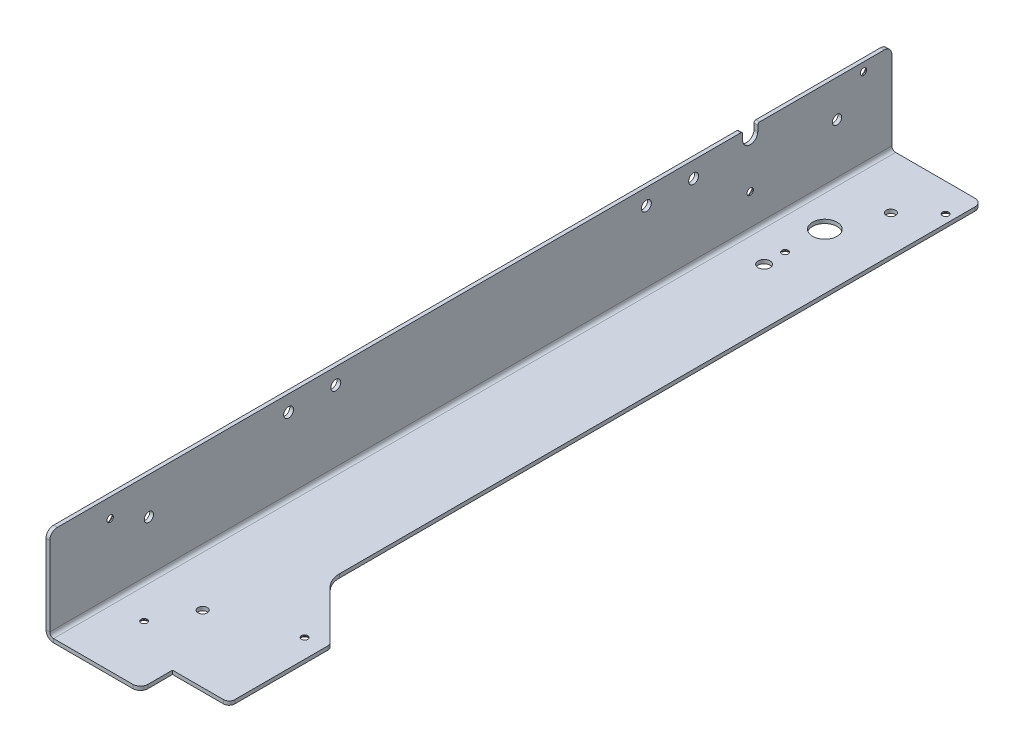
from build123d import *

# Parameters (mm, degrees)
BOSS_EXTRUDE1_DEPTH                            = 2
HOLE1_D                                        = 5.25
HOLE2_D                                        = 5.25
F_13_0_13_DIAMETER_HOLE1_D                     = 13
F_6_3_6_3_DIAMETER_HOLE1_D                     = 6.3
HOLE3_D                                        = 4.917
CSK_FOR_M3_FLAT_HEAD_MACHINE_SCREW1_AT_2_COUNT = 2
CSK_FOR_M3_FLAT_HEAD_MACHINE_SCREW1_AT_2_PITCH = 399.037905468
CSK_FOR_M3_FLAT_HEAD_MACHINE_SCREW1_AT_3_COUNT = 2
CSK_FOR_M3_FLAT_HEAD_MACHINE_SCREW1_AT_3_PITCH = 56.712388981
CSK_FOR_M3_FLAT_HEAD_MACHINE_SCREW1_AT_4_COUNT = 2
CSK_FOR_M3_FLAT_HEAD_MACHINE_SCREW1_AT_4_PITCH = 407.381733638
CSK_FOR_M3_FLAT_HEAD_MACHINE_SCREW1_AT_5_COUNT = 2
CSK_FOR_M3_FLAT_HEAD_MACHINE_SCREW1_AT_5_PITCH = 343.793917126
CSK_FOR_M3_FLAT_HEAD_MACHINE_SCREW1_AT_6_COUNT = 2
CSK_FOR_M3_FLAT_HEAD_MACHINE_SCREW1_AT_6_PITCH = 112.305538429
CSK_FOR_M3_FLAT_HEAD_MACHINE_SCREW1_AT_7_COUNT = 2
CSK_FOR_M3_FLAT_HEAD_MACHINE_SCREW1_AT_7_PITCH = 339.560377547
SKETCHED_START                                 = -46.712388981
SKETCHED_BEND1_OUTLINE_W                       = 2
SKETCHED_BEND1_OUTLINE_H                       = 446
SKETCHED_BEND1_DEPTH                           = 47.123348981
SKETCHED_START_2                               = 1.400733564
SKETCHED_BEND1_2_OUTLINE_R                     = 1.7
SKETCHED_BEND1_2_OUTLINE_R_2                   = 2.4585
SKETCHED_BEND1_2_OUTLINE_R_3                   = 2.625
SKETCHED_BEND1_2_DEPTH                         = 0.599266436
SKETCHED_BEND1_3_OUTLINE_R                     = 1.7
SKETCHED_BEND1_3_OUTLINE_R_2                   = 2.4585
SKETCHED_BEND1_3_OUTLINE_R_3                   = 2.625
SKETCHED_BEND1_3_DEPTH                         = 4
SKETCHED_START_3                               = -224
SKETCHED_BEND1_4_DEPTH                         = 448


with BuildPart() as part:
    # Sketch5 → Boss-Extrude1 (new body)
    with BuildSketch(Plane.XZ):
        with BuildLine():
            Line((46, 223), (-42.712388981, 223))
            ThreePointArc((-42.712388981, 223), (-45.540816105, 221.828427125), (-46.712388981, 219))
            Line((-46.712388981, 219), (-46.712388981, -143))
            ThreePointArc((-46.712388981, -143), (-46.419495767, -143.707106769), (-45.712388998, -143.999999983))
            Line((-45.712388998, -143.999999983), (-42.712388996, -143.999999983))
            ThreePointArc((-42.712388996, -143.999999983), (-38.712388981, -147.999999998), (-42.712388996, -152.000000013))
            Line((-42.712388996, -152.000000013), (-45.712388993, -152.000000013))
            ThreePointArc((-45.712388993, -152.000000013), (-46.419495765, -152.292893228), (-46.712388981, -153))
            Line((-46.712388981, -153), (-46.712388981, -219))
            ThreePointArc((-46.712388981, -219), (-45.540816105, -221.828427125), (-42.712388981, -223))
            Line((-42.712388981, -223), (46, -223))
            ThreePointArc((46, -223), (48.828427126, -221.828427124), (50.000000002, -218.999999998))
            Line((50.000000002, -218.999999998), (50.000000002, 117.529437254))
            ThreePointArc((50.000000002, 117.529437254), (50.91344561, 122.121638435), (53.514718622, 126.014718614))
            Line((53.514718622, 126.014718614), (79.121320339, 151.621320331))
            ThreePointArc((79.121320339, 151.621320331), (79.771638601, 152.594590389), (80.000000006, 153.742640699))
            Line((80.000000006, 153.742640699), (80.000000006, 203.000000012))
            ThreePointArc((80.000000006, 203.000000012), (79.121320352, 205.12132035), (77.000000014, 206.000000004))
            Line((77.000000014, 206.000000004), (50.000000002, 206.000000004))
            Line((50.000000002, 206.000000004), (50.000000002, 218.999999998))
            ThreePointArc((50.000000002, 218.999999998), (48.828427126, 221.828427124), (46, 223))
        make_face()
    extrude(amount=-BOSS_EXTRUDE1_DEPTH)

    # Hole1 (through all)
    with Locations(Plane(origin=(0, 0, 0), x_dir=(-1, 0, 0), z_dir=(0, -1, 0))):
        with Locations((38.212388981, 118)):
            Hole(HOLE1_D / 2)

    # Hole2 (through all)
    with Locations(Plane(origin=(0, 2, 0), x_dir=(1, 0, 0), z_dir=(0, 1, 0))):
        with Locations((-38.212388981, 93), (-38.212388981, -71.5), (-38.212388981, -96.5)):
            Hole(HOLE2_D / 2)

    # Ø13.0 (13) Diameter Hole1 (through all)
    with Locations(Plane(origin=(0, 2, 0), x_dir=(1, 0, 0), z_dir=(0, 1, 0))):
        with Locations((20.5, 169)):
            Hole(F_13_0_13_DIAMETER_HOLE1_D / 2)

    # Ø6.3 (6.3) Diameter Hole1 (through all)
    with Locations(Plane(origin=(0, 2, 0), x_dir=(1, 0, 0), z_dir=(0, 1, 0))):
        with Locations((20.5, 136.85)):
            Hole(F_6_3_6_3_DIAMETER_HOLE1_D / 2)

    # Hole3 (through all)
    with Locations(Plane(origin=(0, 2, 0), x_dir=(1, 0, 0), z_dir=(0, 1, 0))):
        with Locations((30.5, -170.5), (30.5, 194), (-27.212388981, -170.5), (-27.212388981, 194)):
            Hole(HOLE3_D / 2)

    # Sketch16 → CSK for M3 Flat Head Machine Screw1 (revolve, cut)
    with BuildSketch(Plane(origin=(-36.712388981, 0, 191), x_dir=(0, 0, -1), z_dir=(1, 0, 0))):
        Polygon((0, 0), (0, 2), (1.7, 2), (1.7, 1.450000002), (3.149999999, 0), align=None)
    csk_for_m3_flat_head_machine_screw1 = revolve(axis=Axis((-36.712388981, -6.35, 191), (0, 1, 0)), mode=Mode.SUBTRACT)

    # CSK for M3 Flat Head Machine Screw1 at 2: CSK for M3 Flat Head Machine Screw1 ×2
    with Locations(*[Vector(-0.013783151737312926, 0, -0.999905007852339) * (i * CSK_FOR_M3_FLAT_HEAD_MACHINE_SCREW1_AT_2_PITCH) for i in range(1, CSK_FOR_M3_FLAT_HEAD_MACHINE_SCREW1_AT_2_COUNT)]):
        add(csk_for_m3_flat_head_machine_screw1, mode=Mode.SUBTRACT)

    # CSK for M3 Flat Head Machine Screw1 at 3: CSK for M3 Flat Head Machine Screw1 ×2
    with Locations(*[(i * CSK_FOR_M3_FLAT_HEAD_MACHINE_SCREW1_AT_3_PITCH, 0, 0) for i in range(1, CSK_FOR_M3_FLAT_HEAD_MACHINE_SCREW1_AT_3_COUNT)]):
        add(csk_for_m3_flat_head_machine_screw1, mode=Mode.SUBTRACT)

    # CSK for M3 Flat Head Machine Screw1 at 4: CSK for M3 Flat Head Machine Screw1 ×2
    with Locations(*[Vector(0.20180676302394304, 0, -0.9794253572364757) * (i * CSK_FOR_M3_FLAT_HEAD_MACHINE_SCREW1_AT_4_PITCH) for i in range(1, CSK_FOR_M3_FLAT_HEAD_MACHINE_SCREW1_AT_4_COUNT)]):
        add(csk_for_m3_flat_head_machine_screw1, mode=Mode.SUBTRACT)

    # CSK for M3 Flat Head Machine Screw1 at 5: CSK for M3 Flat Head Machine Screw1 ×2
    with Locations(*[Vector(0.16641477969952015, 0, -0.9860558407603295) * (i * CSK_FOR_M3_FLAT_HEAD_MACHINE_SCREW1_AT_5_PITCH) for i in range(1, CSK_FOR_M3_FLAT_HEAD_MACHINE_SCREW1_AT_5_COUNT)]):
        add(csk_for_m3_flat_head_machine_screw1, mode=Mode.SUBTRACT)

    # CSK for M3 Flat Head Machine Screw1 at 6: CSK for M3 Flat Head Machine Screw1 ×2
    with Locations(*[Vector(0.9501970292191413, 0, -0.31164981255107205) * (i * CSK_FOR_M3_FLAT_HEAD_MACHINE_SCREW1_AT_6_PITCH) for i in range(1, CSK_FOR_M3_FLAT_HEAD_MACHINE_SCREW1_AT_6_COUNT)]):
        add(csk_for_m3_flat_head_machine_screw1, mode=Mode.SUBTRACT)

    # CSK for M3 Flat Head Machine Screw1 at 7: CSK for M3 Flat Head Machine Screw1 ×2
    with Locations(*[Vector(0.057427194953831716, 0, -0.9983496968896894) * (i * CSK_FOR_M3_FLAT_HEAD_MACHINE_SCREW1_AT_7_PITCH) for i in range(1, CSK_FOR_M3_FLAT_HEAD_MACHINE_SCREW1_AT_7_COUNT)]):
        add(csk_for_m3_flat_head_machine_screw1, mode=Mode.SUBTRACT)

    # Sketched Bend1: read off the stored shape, not the designer's step
    # Sketched Bend1 outline → Sketched Bend1 (cut)
    with BuildSketch(Plane.YZ.offset(SKETCHED_START)):
        with Locations((1, 0)):
            Rectangle(SKETCHED_BEND1_OUTLINE_W, SKETCHED_BEND1_OUTLINE_H)
    extrude(amount=SKETCHED_BEND1_DEPTH, mode=Mode.SUBTRACT)

    # Sketched Bend1 2 outline → Sketched Bend1 2 (add)
    with BuildSketch(Plane.YZ.offset(SKETCHED_START_2)):
        with BuildLine():
            Line((2, -223), (46, -223))
            ThreePointArc((46, -223), (48.828427125, -221.828427125), (50, -219))
            Line((50, -219), (50, -153))
            ThreePointArc((50, -153), (49.707106785, -152.292893228), (49.000000013, -152.000000012))
            Line((49.000000013, -152.000000012), (46.000000015, -152.000000012))
            ThreePointArc((46.000000015, -152.000000012), (42, -147.999999997), (46.000000015, -143.999999983))
            Line((46.000000015, -143.999999983), (49.000000017, -143.999999983))
            ThreePointArc((49.000000017, -143.999999983), (49.707106786, -143.707106769), (50, -143))
            Line((50, -143), (50, 219))
            ThreePointArc((50, 219), (48.828427125, 221.828427125), (46, 223))
            Line((46, 223), (2, 223))
            Line((2, 223), (2, -223))
        make_face()
        with Locations((20.5, -148)):
            Circle(SKETCHED_BEND1_2_OUTLINE_R, mode=Mode.SUBTRACT)
        with Locations((30.5, -194)):
            Circle(SKETCHED_BEND1_2_OUTLINE_R_2, mode=Mode.SUBTRACT)
        with Locations((45.5, -208)):
            Circle(SKETCHED_BEND1_2_OUTLINE_R, mode=Mode.SUBTRACT)
        with Locations((41.5, -118)):
            Circle(SKETCHED_BEND1_2_OUTLINE_R_3, mode=Mode.SUBTRACT)
        with Locations((41.5, -93)):
            Circle(SKETCHED_BEND1_2_OUTLINE_R_3, mode=Mode.SUBTRACT)
        with Locations((41.5, 71.5)):
            Circle(SKETCHED_BEND1_2_OUTLINE_R_3, mode=Mode.SUBTRACT)
        with Locations((41.5, 96.5)):
            Circle(SKETCHED_BEND1_2_OUTLINE_R_3, mode=Mode.SUBTRACT)
        with Locations((30.5, 170.5)):
            Circle(SKETCHED_BEND1_2_OUTLINE_R_2, mode=Mode.SUBTRACT)
        with Locations((40, 191)):
            Circle(SKETCHED_BEND1_2_OUTLINE_R, mode=Mode.SUBTRACT)
    extrude(amount=SKETCHED_BEND1_2_DEPTH)

    # Sketched Bend1 3 outline → Sketched Bend1 3 (add)
    with BuildSketch(Plane.YZ):
        with BuildLine():
            Line((2, -223), (46, -223))
            ThreePointArc((46, -223), (48.828427125, -221.828427125), (50, -219))
            Line((50, -219), (50, -153))
            ThreePointArc((50, -153), (49.707106785, -152.292893228), (49.000000013, -152.000000012))
            Line((49.000000013, -152.000000012), (46.000000015, -152.000000012))
            ThreePointArc((46.000000015, -152.000000012), (42, -147.999999997), (46.000000015, -143.999999983))
            Line((46.000000015, -143.999999983), (49.000000017, -143.999999983))
            ThreePointArc((49.000000017, -143.999999983), (49.707106786, -143.707106769), (50, -143))
            Line((50, -143), (50, 219))
            ThreePointArc((50, 219), (48.828427125, 221.828427125), (46, 223))
            Line((46, 223), (2, 223))
            Line((2, 223), (2, -223))
        make_face()
        with Locations((20.5, -148)):
            Circle(SKETCHED_BEND1_3_OUTLINE_R, mode=Mode.SUBTRACT)
        with Locations((30.5, -194)):
            Circle(SKETCHED_BEND1_3_OUTLINE_R_2, mode=Mode.SUBTRACT)
        with Locations((45.5, -208)):
            Circle(SKETCHED_BEND1_3_OUTLINE_R, mode=Mode.SUBTRACT)
        with Locations((41.5, -118)):
            Circle(SKETCHED_BEND1_3_OUTLINE_R_3, mode=Mode.SUBTRACT)
        with Locations((41.5, -93)):
            Circle(SKETCHED_BEND1_3_OUTLINE_R_3, mode=Mode.SUBTRACT)
        with Locations((41.5, 71.5)):
            Circle(SKETCHED_BEND1_3_OUTLINE_R_3, mode=Mode.SUBTRACT)
        with Locations((41.5, 96.5)):
            Circle(SKETCHED_BEND1_3_OUTLINE_R_3, mode=Mode.SUBTRACT)
        with Locations((30.5, 170.5)):
            Circle(SKETCHED_BEND1_3_OUTLINE_R_2, mode=Mode.SUBTRACT)
        with Locations((40, 191)):
            Circle(SKETCHED_BEND1_3_OUTLINE_R, mode=Mode.SUBTRACT)
    extrude(amount=SKETCHED_BEND1_3_DEPTH)

    # Sketched Bend1 4 outline → Sketched Bend1 4 (cut)
    with BuildSketch(Plane.XY.offset(SKETCHED_START_3)):
        with BuildLine():
            Line((4, 50), (2, 50))
            Line((2, 50), (2, 4))
            ThreePointArc((2, 4), (2.585786437, 2.585786437), (4, 2))
            Line((4, 2), (4, 50))
        make_face()
        with BuildLine():
            ThreePointArc((4, 0), (1.171572875, 1.171572875), (0, 4))
            Line((0, 4), (0, 2))
            Line((0, 2), (0.41096, 2))
            Line((0.41096, 2), (0.41096, 0))
            Line((0.41096, 0), (4, 0))
        make_face()
    extrude(amount=SKETCHED_BEND1_4_DEPTH, mode=Mode.SUBTRACT)

    # Sketched Bend1 5 outline → Sketched Bend1 5 (revolve, cut)
    with BuildSketch(Plane(origin=(0, 20.5, -148), x_dir=(0, 1, 0), z_dir=(0, 0, -1))):
        Polygon((3.149999999, 0), (1.7, 1.450000002), (1.7, 0), align=None)
    revolve(axis=Axis((0, 20.5, -148), (1, 0, 0)), mode=Mode.SUBTRACT)

    # Sketched Bend1 6 outline → Sketched Bend1 6 (revolve, cut)
    with BuildSketch(Plane(origin=(0, 45.5, -208), x_dir=(0, 1, 0), z_dir=(0, 0, -1))):
        Polygon((3.149999999, 0), (1.7, 1.450000002), (1.7, 0), align=None)
    revolve(axis=Axis((0, 45.5, -208), (1, 0, 0)), mode=Mode.SUBTRACT)

    # Sketched Bend1 7 outline → Sketched Bend1 7 (revolve, cut)
    with BuildSketch(Plane(origin=(0, 40, 191), x_dir=(0, 1, 0), z_dir=(0, 0, -1))):
        Polygon((3.149999999, 0), (1.7, 1.450000002), (1.7, 0), align=None)
    revolve(axis=Axis((0, 40, 191), (1, 0, 0)), mode=Mode.SUBTRACT)


solid = part.part
